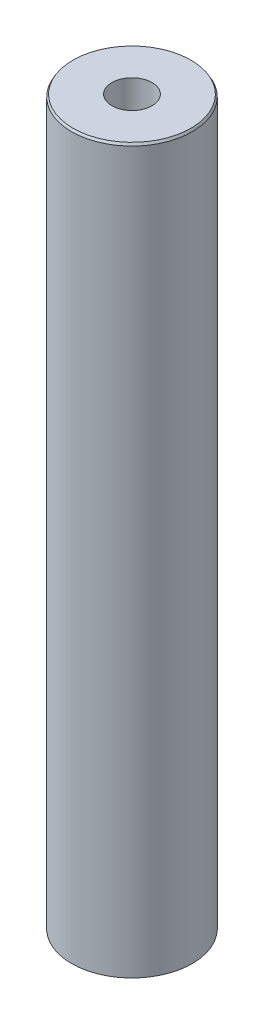
from build123d import *
from OCP.BRepFilletAPI import BRepFilletAPI_MakeChamfer

# Parameters (mm, degrees)
SKETCH1_R           = 50
BOSS_EXTRUDE1_DEPTH = 600
SKETCH2_R           = 16.650541619
CUT_EXTRUDE1_DEPTH  = 605.15229868
CHAMFER1_SIZE       = 1.929716502
CHAMFER1_SIZE2      = 1.114122342


with BuildPart() as part:
    # Sketch1 → Boss-Extrude1 (new body)
    with BuildSketch(Plane(origin=(0, 0, 0), x_dir=(1, 0, 0), z_dir=(0, 1, 0))):
        Circle(SKETCH1_R)
    extrude(amount=BOSS_EXTRUDE1_DEPTH)

    # Sketch2 → Cut-Extrude1 (cut, through all)
    with BuildSketch(Plane(origin=(0, 0, 0), x_dir=(1, 0, 0), z_dir=(0, 1, 0))):
        Circle(SKETCH2_R)
    extrude(amount=CUT_EXTRUDE1_DEPTH, mode=Mode.SUBTRACT)

    # Chamfer1: one chamfer whose edges measure the first distance from different faces: ONE call of the kernel's chamfer builder (chamfer() names one face for all edges)
    chamfer1_edges_1 = [part.edges().sort_by_distance(p)[0] for p in [
        (-50, 600, 0),
    ]]
    chamfer1_side_1 = [part.faces().sort_by_distance(p)[0] for p in [
        (-50, 300, 0),
    ]]
    chamfer1_edges_2 = [part.edges().sort_by_distance(p)[0] for p in [
        (-50, 0, 0),
    ]]
    chamfer1_side_2 = [part.faces().sort_by_distance(p)[0] for p in [
        (-48.585786438, 0, 0),
    ]]
    chamfer1 = BRepFilletAPI_MakeChamfer(part.part.solid().wrapped)
    for e in chamfer1_edges_1:
        chamfer1.Add(CHAMFER1_SIZE, CHAMFER1_SIZE2, e.wrapped, chamfer1_side_1[0].wrapped)  # the first distance lies on this face
    for e in chamfer1_edges_2:
        chamfer1.Add(CHAMFER1_SIZE, CHAMFER1_SIZE2, e.wrapped, chamfer1_side_2[0].wrapped)  # the first distance lies on this face
    add(Compound.cast(chamfer1.Shape()), mode=Mode.REPLACE)


solid = part.part
